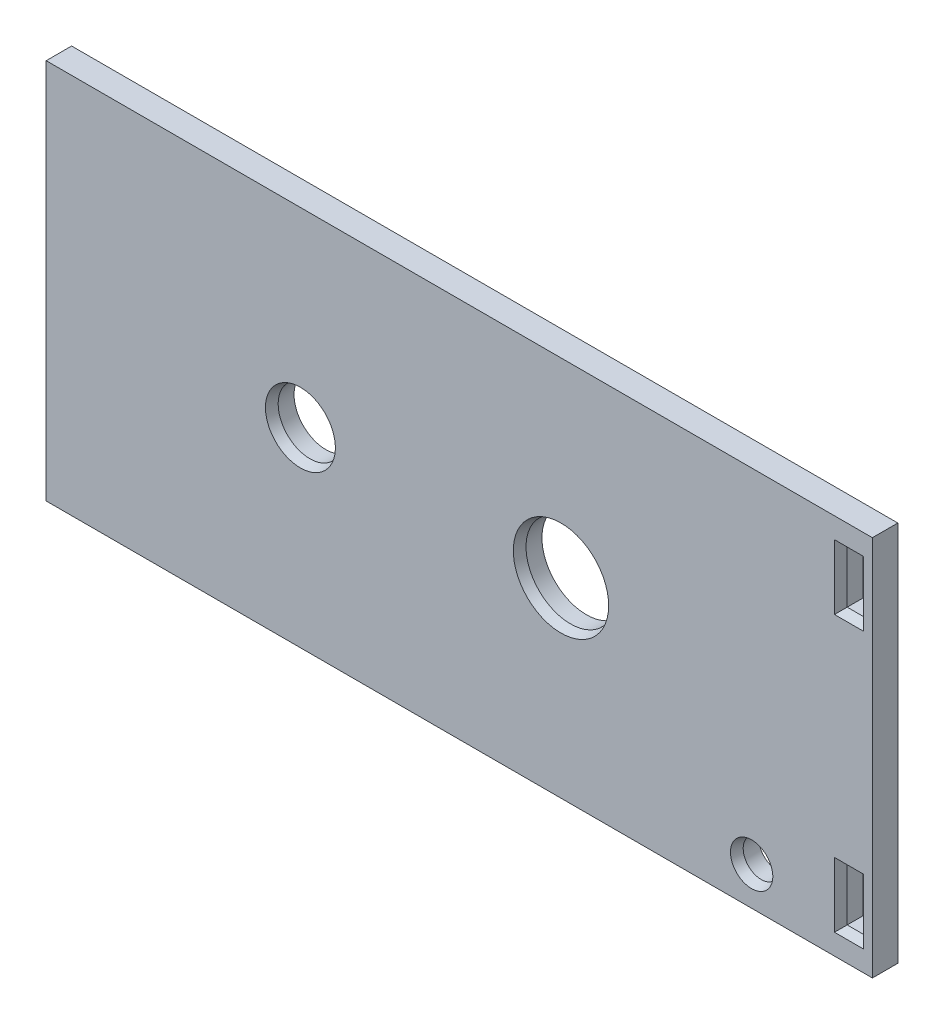
from build123d import *

# Parameters (mm, degrees)
SKETCH1_W           = 130
SKETCH1_H           = 60
SKETCH1_R           = 5
SKETCH1_R_2         = 2.83
SKETCH1_R_3         = 7
SKETCH1_W_2         = 3.53
SKETCH1_H_2         = 9.2
BOSS_EXTRUDE1_DEPTH = 2
CHAMFER1_SIZE       = 0.5
CHAMFER1_SIZE2      = 1.5


with BuildPart() as part:
    # Sketch1 → Boss-Extrude1 (new, symmetric)
    with BuildSketch(Plane.XY):
        Rectangle(SKETCH1_W, SKETCH1_H)
        with Locations((-25, 0)):
            Circle(SKETCH1_R, mode=Mode.SUBTRACT)
        with Locations((46, -24)):
            Circle(SKETCH1_R_2, mode=Mode.SUBTRACT)
        with Locations((16, 0)):
            Circle(SKETCH1_R_3, mode=Mode.SUBTRACT)
        with Locations((61.3, 21.65)):
            Rectangle(SKETCH1_W_2, SKETCH1_H_2, mode=Mode.SUBTRACT)
        with Locations((61.3, -21.65)):
            Rectangle(SKETCH1_W_2, SKETCH1_H_2, mode=Mode.SUBTRACT)
    extrude(amount=BOSS_EXTRUDE1_DEPTH, both=True)

    # Chamfer1
    chamfer1_edges = [part.edges().sort_by_distance(p)[0] for p in [
        (61.3, 17.05, 2),
        (59.535, 21.65, 2),
        (61.3, 26.25, 2),
        (63.065, 21.65, 2),
        (-30, 0, 2),
        (43.17, -24, 2),
        (61.3, -26.25, 2),
        (59.535, -21.65, 2),
        (61.3, -17.05, 2),
        (63.065, -21.65, 2),
        (9, 0, 2),
    ]]
    chamfer1_side = [part.faces().sort_by_distance(p)[0] for p in [
        (-0.754066384, 0.080757492, 2),
    ]]
    chamfer(chamfer1_edges, length=CHAMFER1_SIZE, length2=CHAMFER1_SIZE2, reference=chamfer1_side[0])


solid = part.part
